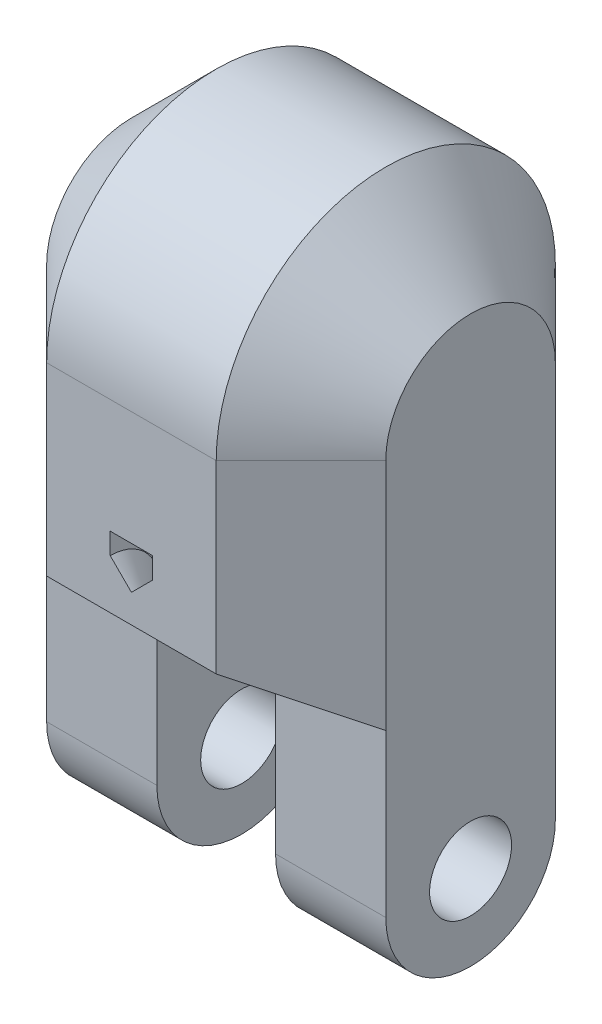
from build123d import *

# Parameters (mm, degrees)
BOSS_EXTRUDE1_DEPTH     = 5
CUT_EXTRUDE8_DEPTH      = 10.848857802
CUT_EXTRUDE8_DEPTH_BACK = 10.848857802
REVOLVE1_ANGLE          = 180
SKETCH24_W              = 3.9
SKETCH24_H              = 6
BOSS_EXTRUDE2_DEPTH     = 4
SKETCH25_W              = 3.9
SKETCH25_H              = 3
REVOLVE2_ANGLE          = 180
SKETCH26_R              = 1.45
CUT_EXTRUDE9_DEPTH      = 19
BOSS_EXTRUDE4_DEPTH     = 3.75


with BuildPart() as part:
    # Sketch2 → Boss-Extrude1 (new, symmetric)
    with BuildSketch(Plane(origin=(0, 0, 0), x_dir=(1, 0, 0), z_dir=(0, 1, 0))):
        Polygon((-3, 6), (3, 6), (6, 3), (6, -3), (3, -6), (-3, -6), (-6, -3), (-6, 3), align=None)
    extrude(amount=BOSS_EXTRUDE1_DEPTH, both=True)

    # Sketch22 → Cut-Extrude8 (cut, two sides: drawn at the far end of the back side and taken through both)
    with BuildSketch(Plane(origin=(0, 0, 0), x_dir=(0, 0, -1), z_dir=(1, 0, 0)).offset(-CUT_EXTRUDE8_DEPTH_BACK)):
        Polygon((0, -5), (-6, -5), (-6, -1.535898385), align=None)
    extrude(amount=CUT_EXTRUDE8_DEPTH + CUT_EXTRUDE8_DEPTH_BACK, mode=Mode.SUBTRACT)

    # Sketch23 → Revolve1 (revolve)
    with BuildSketch(Plane(origin=(0, 5, 0), x_dir=(1, 0, 0), z_dir=(0, 1, 0))):
        Polygon((-6, 0), (-6, 3), (-3, 6), (3, 6), (6, 3), (6, 0), align=None)
    revolve(axis=Axis((6, 5, 0), (1, 0, 0)), revolution_arc=REVOLVE1_ANGLE)

    # Sketch24 → Boss-Extrude2 (add, symmetric)
    with BuildSketch(Plane.XZ.offset(5)):
        with Locations((-4.05, 0)):
            Rectangle(SKETCH24_W, SKETCH24_H)
    boss_extrude2 = extrude(amount=BOSS_EXTRUDE2_DEPTH, both=True)

    # Sketch25 → Revolve2 (revolve)
    with BuildSketch(Plane.XZ.offset(9)):
        with Locations((-4.05, 1.5)):
            Rectangle(SKETCH25_W, SKETCH25_H)
    revolve2 = revolve(axis=Axis((-6, -9, 0), (1, 0, 0)), revolution_arc=REVOLVE2_ANGLE)

    # Sketch26 → Cut-Extrude9 (cut, symmetric)
    with BuildSketch(Plane.ZY.offset(6)):
        with Locations((0, -9)):
            Circle(SKETCH26_R)
    cut_extrude9 = extrude(amount=CUT_EXTRUDE9_DEPTH, both=True, mode=Mode.SUBTRACT)

    # Mirror1: Boss-Extrude2, Revolve2, Cut-Extrude9 across plane
    add(boss_extrude2.mirror(Plane(origin=(0, 0, 0), x_dir=(0, 0, 1), z_dir=(1, 0, 0))))
    add(revolve2.mirror(Plane(origin=(0, 0, 0), x_dir=(0, 0, 1), z_dir=(1, 0, 0))))
    add(cut_extrude9.mirror(Plane(origin=(0, 0, 0), x_dir=(0, 0, 1), z_dir=(1, 0, 0))), mode=Mode.SUBTRACT)

    # Sketch30 → Cut-Revolve1 (revolve, cut)
    with BuildSketch(Plane(origin=(0, -3.75, 2.165063509), x_dir=(1, 0, 0), z_dir=(0, -0.8660254037844418, 0.49999999999999484))):
        Polygon((0, 3.42820323), (-0.75, 2.67820323), (-0.75, 1.92820323), (0.75, 1.92820323), (0.75, 2.67820323), align=None)
    revolve(axis=Axis((-6, -1.535898385, 6), (1, 0, 0)), mode=Mode.SUBTRACT)

    # Sketch34 → Boss-Extrude4 (add)
    with BuildSketch(Plane.XZ.offset(5)):
        Polygon((-6, -3), (-2.1, -3), (2.1, -3), (6, -3), (3, -6), (-3, -6), align=None)
    extrude(amount=BOSS_EXTRUDE4_DEPTH)

    # Sketch35 → Cut-Revolve3 (revolve, cut)
    with BuildSketch(Plane.XZ.offset(8.75)):
        Polygon((0, -3.5), (-0.75, -4.25), (-0.75, -5), (0.75, -5), (0.75, -4.25), align=None)
    revolve(axis=Axis((3, -8.75, -6), (1, 0, 0)), mode=Mode.SUBTRACT)


solid = part.part
